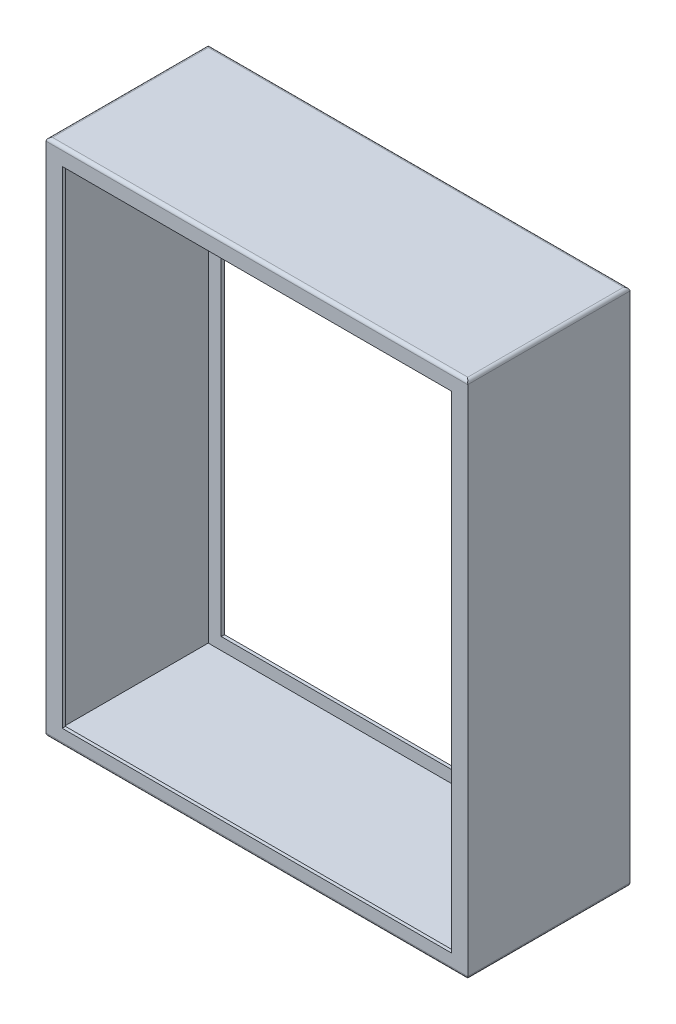
from build123d import *

# Parameters (mm, degrees)
SKETCH2_W           = 330.2
SKETCH2_H           = 406.4
BOSS_EXTRUDE1_DEPTH = 127
FILLET1_R           = 2.54
FILLET2_R           = 2.54
SKETCH3_W           = 304.8
SKETCH3_H           = 381
CUT_EXTRUDE1_DEPTH  = 127
SHELL4_START        = 2.54
SHELL4_OUTLINE_W    = 401.32
SHELL4_OUTLINE_H    = 121.92
SHELL4_DEPTH        = 325.12


# Read off the part's stored shape, not the designer's step: Shell4
with BuildPart() as part:
    # Sketch2 → Boss-Extrude1 (new body)
    with BuildSketch(Plane.XY):
        with Locations((165.1, 203.2)):
            Rectangle(SKETCH2_W, SKETCH2_H)
    extrude(amount=BOSS_EXTRUDE1_DEPTH)

    # Fillet1
    fillet1_edges = [part.edges().sort_by_distance(p)[0] for p in [
        (165.1, 406.4, 127),
        (165.1, 406.4, 0),
        (0, 406.4, 63.5),
        (330.2, 406.4, 63.5),
    ]]
    fillet(fillet1_edges, radius=FILLET1_R)

    # Fillet2
    fillet2_edges = [part.edges().sort_by_distance(p)[0] for p in [
        (165.1, 0, 0),
        (330.2, 0, 63.5),
        (0, 0, 63.5),
        (165.1, 0, 127),
    ]]
    fillet(fillet2_edges, radius=FILLET2_R)

    # Sketch3 → Cut-Extrude1 (cut)
    with BuildSketch(Plane.XY.offset(127)):
        with Locations((165.1, 202.565)):
            Rectangle(SKETCH3_W, SKETCH3_H)
    extrude(amount=-CUT_EXTRUDE1_DEPTH, mode=Mode.SUBTRACT)

    # Shell4 outline → Shell4 (cut)
    with BuildSketch(Plane.YZ.offset(SHELL4_START)):
        with Locations((203.2, 63.5)):
            Rectangle(SHELL4_OUTLINE_W, SHELL4_OUTLINE_H)
    extrude(amount=SHELL4_DEPTH, mode=Mode.SUBTRACT)


solid = part.part
